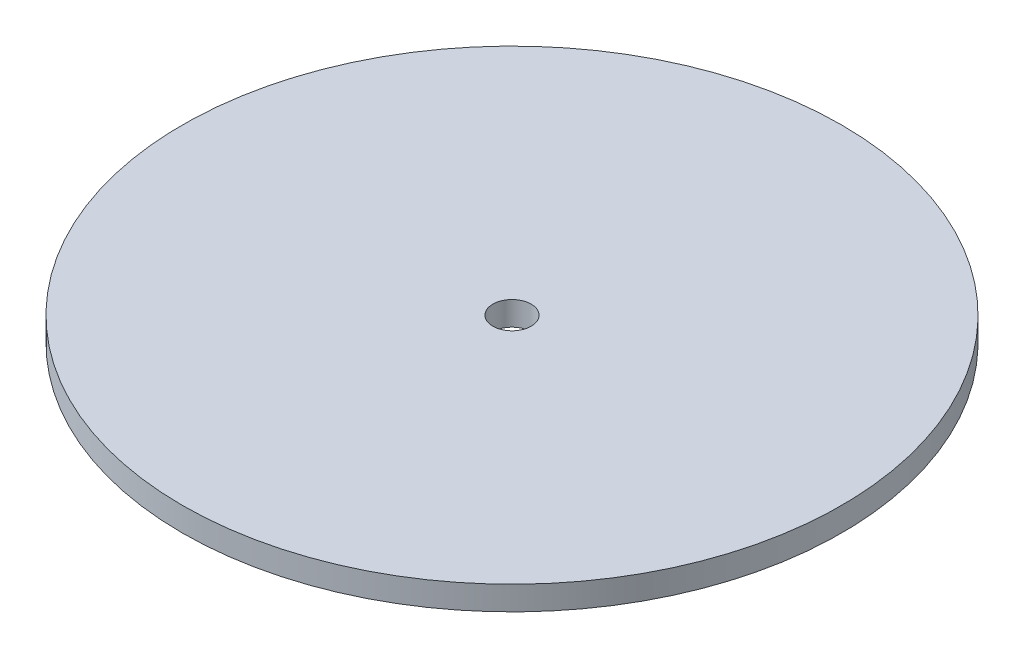
from build123d import *

# Parameters (mm, degrees)
SKETCH2_R           = 137.5
BOSS_EXTRUDE1_DEPTH = 10
SKETCH4_R           = 8
CUT_EXTRUDE1_DEPTH  = 195.711324786


with BuildPart() as part:
    # Sketch2 → Boss-Extrude1 (new body)
    with BuildSketch(Plane(origin=(0, 0, 0), x_dir=(1, 0, 0), z_dir=(0, 1, 0))):
        Circle(SKETCH2_R)
    extrude(amount=BOSS_EXTRUDE1_DEPTH)

    # Sketch4 → Cut-Extrude1 (cut, through all)
    with BuildSketch(Plane(origin=(0, 10, 0), x_dir=(1, 0, 0), z_dir=(0, 1, 0))):
        Circle(SKETCH4_R)
    extrude(amount=-CUT_EXTRUDE1_DEPTH, mode=Mode.SUBTRACT)


solid = part.part
